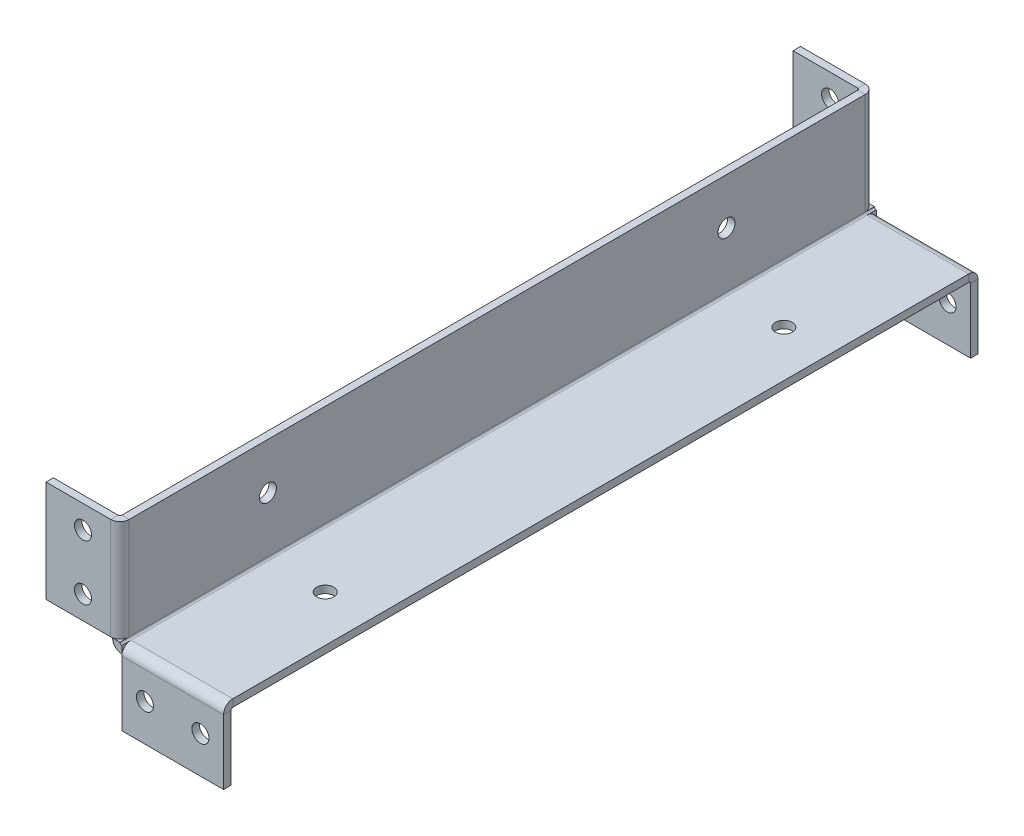
from build123d import *

# Parameters (mm, degrees)
SKETCH1_W                      = 60
SKETCH1_H                      = 408
BASE_FLANGE1_DEPTH             = 4
EDGE_FLANGE1_STRIP_W           = 18
EDGE_FLANGE1_STRIP_H           = 4
EDGE_FLANGE1_STRIP_CUT_DEPTH   = 408
EDGE_FLANGE1_DEPTH             = 408
EDGE_FLANGE2_STRIP_W           = 18
EDGE_FLANGE2_STRIP_H           = 4
EDGE_FLANGE2_STRIP_CUT_DEPTH   = 55
EDGE_FLANGE2_STRIP_2_W         = 18
EDGE_FLANGE2_STRIP_2_H         = 4
EDGE_FLANGE2_STRIP_CUT_2_DEPTH = 55
EDGE_FLANGE2_STRIP_3_W         = 18
EDGE_FLANGE2_STRIP_3_H         = 4
EDGE_FLANGE2_STRIP_CUT_3_DEPTH = 55
EDGE_FLANGE2_STRIP_4_W         = 18
EDGE_FLANGE2_STRIP_4_H         = 4
EDGE_FLANGE2_STRIP_CUT_4_DEPTH = 55
EDGE_FLANGE2_DEPTH             = 55
EDGE_FLANGE2_BEND_DEPTH        = 55
EDGE_FLANGE2_BEND_2_DEPTH      = 55
EDGE_FLANGE2_BEND_3_DEPTH      = 55
SKETCH18_R                     = 4.6
EXTRUDE1_DEPTH                 = 418.636205327
SKETCH19_R                     = 4.6
EXTRUDE2_DEPTH                 = 4
SKETCH20_R                     = 4.6
EXTRUDE3_DEPTH                 = 4


# Sheet-metal steps are written as plain solids
with BuildPart() as part:
    # Sketch1 → Base-Flange1 (new body)
    with BuildSketch(Plane(origin=(0, 0, 0), x_dir=(1, 0, 0), z_dir=(0, 1, 0))):
        Rectangle(SKETCH1_W, SKETCH1_H)
    extrude(amount=BASE_FLANGE1_DEPTH)

    # Edge-Flange1 strip (across the edge) → Edge-Flange1 strip cut (cut)
    with BuildSketch(Plane(origin=(-30, 4, -204), x_dir=(1, 0, 0), z_dir=(0, 0, 1))):
        with Locations((-4, -2)):
            Rectangle(EDGE_FLANGE1_STRIP_W, EDGE_FLANGE1_STRIP_H)
    extrude(amount=EDGE_FLANGE1_STRIP_CUT_DEPTH, mode=Mode.SUBTRACT)

    # Edge-Flange1 section (across the edge) → Edge-Flange1 (add)
    with BuildSketch(Plane(origin=(-30, 4, -204), x_dir=(1, 0, 0), z_dir=(0, 0, 1))):
        with BuildLine():
            Line((0, 1), (0, 56))
            Line((0, 56), (4, 56))
            Line((4, 56), (4, 1))
            ThreePointArc((4, 1), (4.292893219, 0.292893219), (5, 0))
            Line((5, 0), (5, -4))
            ThreePointArc((5, -4), (1.464466094, -2.535533906), (0, 1))
        make_face()
    extrude(amount=EDGE_FLANGE1_DEPTH)

    # Edge-Flange2 strip (across the edge) → Edge-Flange2 strip cut (cut)
    with BuildSketch(Plane(origin=(-30, 5, 204), x_dir=(0, 0, -1), z_dir=(0, 1, 0))):
        with Locations((-4, -2)):
            Rectangle(EDGE_FLANGE2_STRIP_W, EDGE_FLANGE2_STRIP_H)
    extrude(amount=EDGE_FLANGE2_STRIP_CUT_DEPTH, mode=Mode.SUBTRACT)

    # Edge-Flange2 strip 2 (across the edge) → Edge-Flange2 strip cut 2 (cut)
    with BuildSketch(Plane(origin=(30, 0, 204), x_dir=(0, 0, -1), z_dir=(-1, 0, 0))):
        with Locations((-4, -2)):
            Rectangle(EDGE_FLANGE2_STRIP_2_W, EDGE_FLANGE2_STRIP_2_H)
    extrude(amount=EDGE_FLANGE2_STRIP_CUT_2_DEPTH, mode=Mode.SUBTRACT)

    # Edge-Flange2 strip 3 (across the edge) → Edge-Flange2 strip cut 3 (cut)
    with BuildSketch(Plane(origin=(-30, 60, -204), x_dir=(0, 0, 1), z_dir=(0, -1, 0))):
        with Locations((-4, -2)):
            Rectangle(EDGE_FLANGE2_STRIP_3_W, EDGE_FLANGE2_STRIP_3_H)
    extrude(amount=EDGE_FLANGE2_STRIP_CUT_3_DEPTH, mode=Mode.SUBTRACT)

    # Edge-Flange2 strip 4 (across the edge) → Edge-Flange2 strip cut 4 (cut)
    with BuildSketch(Plane(origin=(-25, 0, -204), x_dir=(0, 0, 1), z_dir=(1, 0, 0))):
        with Locations((-4, -2)):
            Rectangle(EDGE_FLANGE2_STRIP_4_W, EDGE_FLANGE2_STRIP_4_H)
    extrude(amount=EDGE_FLANGE2_STRIP_CUT_4_DEPTH, mode=Mode.SUBTRACT)

    # Edge-Flange2 section (across the edge) → Edge-Flange2 (add)
    with BuildSketch(Plane(origin=(-30, 5, 204), x_dir=(0, 0, -1), z_dir=(0, 1, 0))):
        with BuildLine():
            Line((0, 1), (0, 36))
            Line((0, 36), (4, 36))
            Line((4, 36), (4, 1))
            ThreePointArc((4, 1), (4.292893219, 0.292893219), (5, 0))
            Line((5, 0), (5, -4))
            ThreePointArc((5, -4), (1.464466094, -2.535533906), (0, 1))
        make_face()
    extrude(amount=EDGE_FLANGE2_DEPTH)

    # Edge-Flange2 section 2 (across the edge) → Edge-Flange2 bend (add)
    with BuildSketch(Plane(origin=(30, 0, 204), x_dir=(0, 0, -1), z_dir=(-1, 0, 0))):
        with BuildLine():
            Line((0, 1), (0, 36))
            Line((0, 36), (4, 36))
            Line((4, 36), (4, 1))
            ThreePointArc((4, 1), (4.292893219, 0.292893219), (5, 0))
            Line((5, 0), (5, -4))
            ThreePointArc((5, -4), (1.464466094, -2.535533906), (0, 1))
        make_face()
    extrude(amount=EDGE_FLANGE2_BEND_DEPTH)

    # Edge-Flange2 section 3 (across the edge) → Edge-Flange2 bend 2 (add)
    with BuildSketch(Plane(origin=(-30, 60, -204), x_dir=(0, 0, 1), z_dir=(0, -1, 0))):
        with BuildLine():
            Line((0, 1), (0, 36))
            Line((0, 36), (4, 36))
            Line((4, 36), (4, 1))
            ThreePointArc((4, 1), (4.292893219, 0.292893219), (5, 0))
            Line((5, 0), (5, -4))
            ThreePointArc((5, -4), (1.464466094, -2.535533906), (0, 1))
        make_face()
    extrude(amount=EDGE_FLANGE2_BEND_2_DEPTH)

    # Edge-Flange2 section 4 (across the edge) → Edge-Flange2 bend 3 (add)
    with BuildSketch(Plane(origin=(-25, 0, -204), x_dir=(0, 0, 1), z_dir=(1, 0, 0))):
        with BuildLine():
            Line((0, 1), (0, 36))
            Line((0, 36), (4, 36))
            Line((4, 36), (4, 1))
            ThreePointArc((4, 1), (4.292893219, 0.292893219), (5, 0))
            Line((5, 0), (5, -4))
            ThreePointArc((5, -4), (1.464466094, -2.535533906), (0, 1))
        make_face()
    extrude(amount=EDGE_FLANGE2_BEND_3_DEPTH)

    # Sketch18 → Extrude1 (cut, through all)
    with BuildSketch(Plane.XY.offset(204)):
        with Locations((-46, 47.5)):
            Circle(SKETCH18_R)
        with Locations((-46, 17.5)):
            Circle(SKETCH18_R)
        with Locations((-12.5, -16)):
            Circle(SKETCH18_R)
        with Locations((17.5, -16)):
            Circle(SKETCH18_R)
    extrude(amount=-EXTRUDE1_DEPTH, mode=Mode.SUBTRACT)

    # Sketch19 → Extrude2 (cut)
    with BuildSketch(Plane(origin=(-26, 0, 0), x_dir=(0, 0, -1), z_dir=(1, 0, 0))):
        with Locations(Location((-124, 35, 0), (0, 0, 90))):
            Circle(SKETCH19_R)
        with Locations(Location((124, 35, 0), (0, 0, 90))):
            Circle(SKETCH19_R)
    extrude(amount=-EXTRUDE2_DEPTH, mode=Mode.SUBTRACT)

    # Sketch20 → Extrude3 (cut)
    with BuildSketch(Plane(origin=(0, 4, 0), x_dir=(1, 0, 0), z_dir=(0, 1, 0))):
        with Locations(Location((5, 124, 0), (0, 0, 270))):
            Circle(SKETCH20_R)
        with Locations(Location((5, -124, 0), (0, 0, 270))):
            Circle(SKETCH20_R)
    extrude(amount=-EXTRUDE3_DEPTH, mode=Mode.SUBTRACT)


solid = part.part
